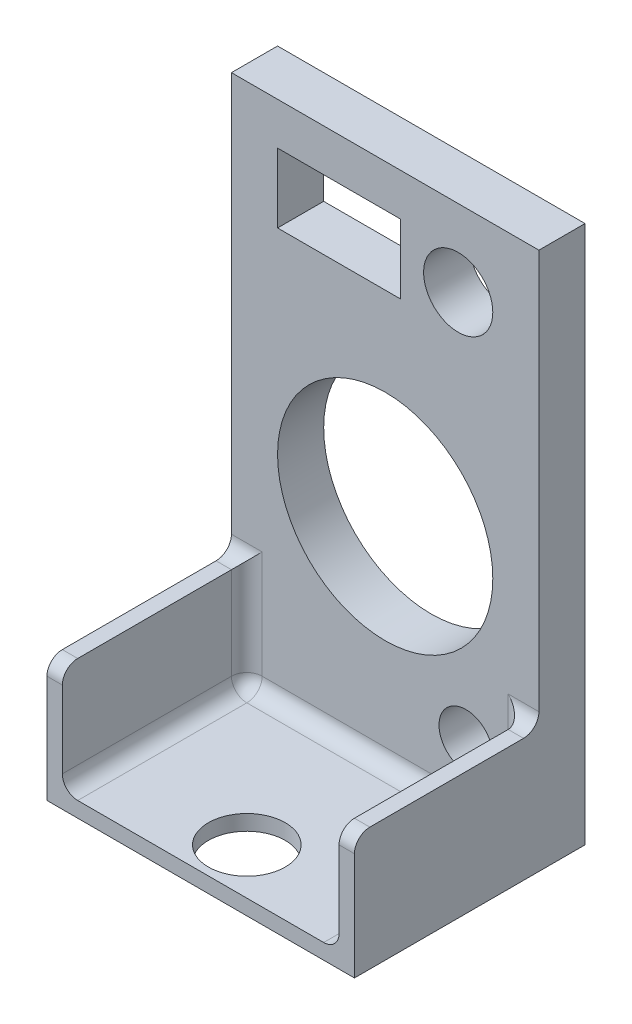
from build123d import *

# Parameters (mm, degrees)
SKETCH1_7_W         = 20
SKETCH1_7_H         = 35
SKETCH1_7_W_2       = 8
SKETCH1_7_H_2       = 4.5
SKETCH1_7_R         = 1.75
SKETCH1_7_R_2       = 7
SKETCH1_7_R_3       = 2.25
BOSS_EXTRUDE2_DEPTH = 3
BOSS_EXTRUDE3_DEPTH = 12
SKETCH2_R           = 2.5
CUT_EXTRUDE1_DEPTH  = 43.05948169
FILLET1_R           = 1


with BuildPart() as part:
    # Sketch1<7> → Boss-Extrude2 (new body)
    with BuildSketch(Plane.XY):
        with Locations((10, 37.5)):
            Rectangle(SKETCH1_7_W, SKETCH1_7_H)
        with Locations((7, 50)):
            Rectangle(SKETCH1_7_W_2, SKETCH1_7_H_2, mode=Mode.SUBTRACT)
        with Locations((15.25, 25)):
            Circle(SKETCH1_7_R, mode=Mode.SUBTRACT)
        with Locations((10, 35)):
            Circle(SKETCH1_7_R_2, mode=Mode.SUBTRACT)
        with Locations((14.75, 50)):
            Circle(SKETCH1_7_R_3, mode=Mode.SUBTRACT)
    extrude(amount=-BOSS_EXTRUDE2_DEPTH)

    # Sketch1<8> → Boss-Extrude3 (add)
    with BuildSketch(Plane.XY):
        Polygon((0, 28), (0, 20), (20, 20), (20, 28), (19, 28), (19, 21), (1, 21), (1, 28), align=None)
    extrude(amount=BOSS_EXTRUDE3_DEPTH)

    # Sketch2 → Cut-Extrude1 (cut, through all)
    with BuildSketch(Plane.XZ.offset(-20)):
        with Locations((10, 9)):
            Circle(SKETCH2_R)
    extrude(amount=-CUT_EXTRUDE1_DEPTH, mode=Mode.SUBTRACT)

    # Fillet1
    fillet1_edges = [part.edges().sort_by_distance(p)[0] for p in [
        (19.5, 28, 12),
        (0.5, 28, 12),
        (1, 24.5, 0),
        (19, 24.5, 0),
        (19, 21, 6),
        (10, 21, 0),
        (1, 21, 6),
        (19.5, 28, 0),
        (0.5, 28, 0),
    ]]
    fillet(fillet1_edges, radius=FILLET1_R)


solid = part.part
